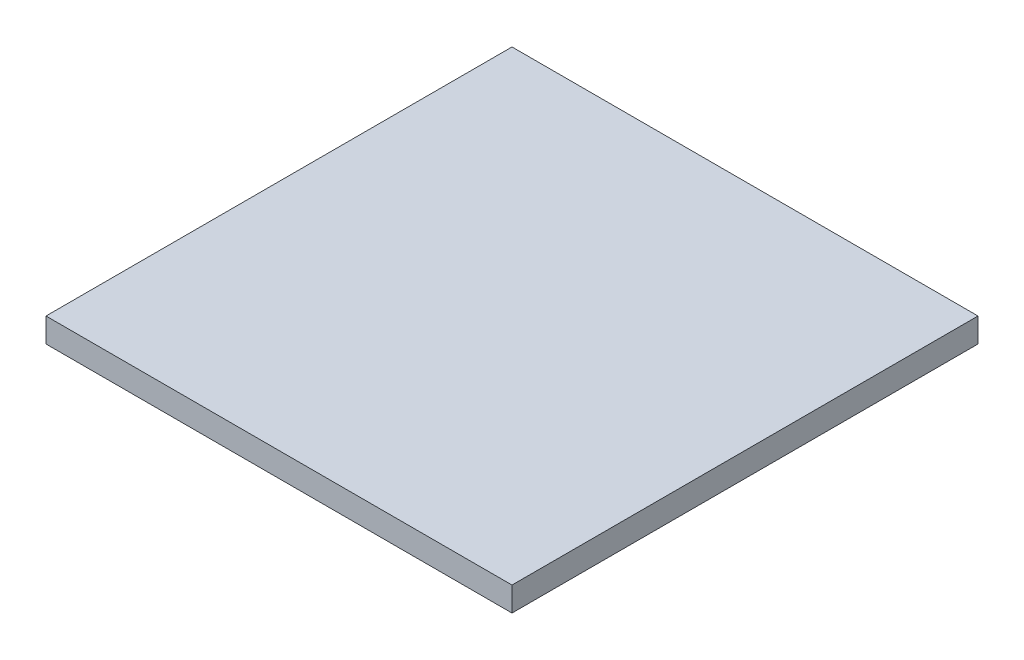
from build123d import *

# Parameters (mm, degrees)
SKETCH1_W           = 5
SKETCH1_H           = 5
BOSS_EXTRUDE1_DEPTH = 96
SKETCH2_W           = 96
SKETCH2_H           = 96
BOSS_EXTRUDE2_DEPTH = 5


with BuildPart() as part:
    # Sketch1 → Boss-Extrude1 (new body)
    with BuildSketch(Plane.XY):
        with Locations((2.5, 2.5)):
            Rectangle(SKETCH1_W, SKETCH1_H)
    extrude(amount=BOSS_EXTRUDE1_DEPTH)

    # Sketch2 → Boss-Extrude2 (add)
    with BuildSketch(Plane(origin=(0, 0, 0), x_dir=(1, 0, 0), z_dir=(0, 1, 0))):
        with Locations((48, -48)):
            Rectangle(SKETCH2_W, SKETCH2_H)
    extrude(amount=BOSS_EXTRUDE2_DEPTH)


solid = part.part
